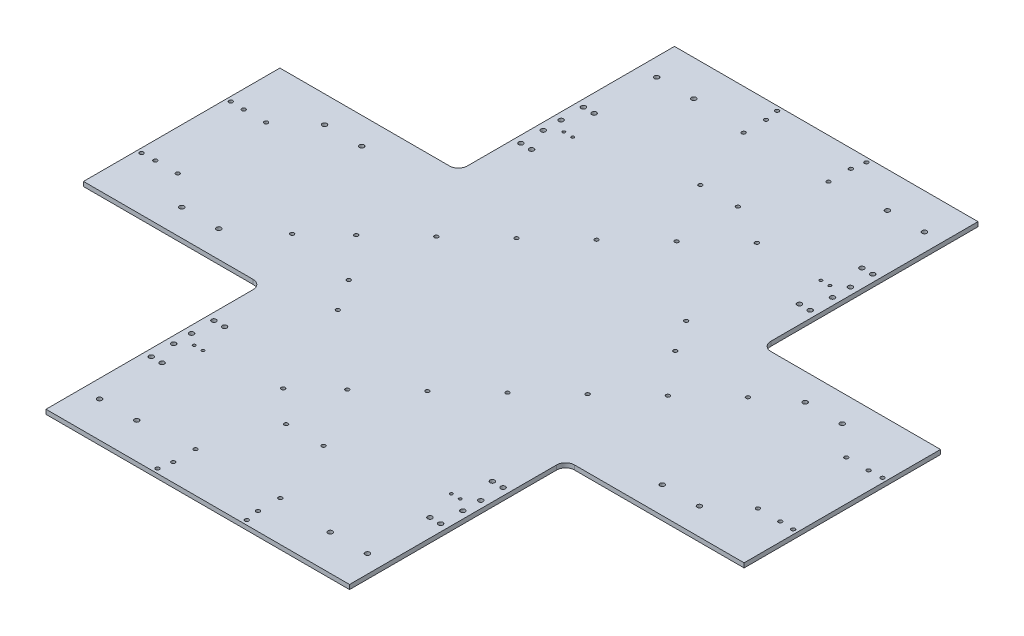
from build123d import *

# Parameters (mm, degrees)
BOSS_EXTRUDE1_DEPTH = 5
SKETCH2_R           = 2.125
CUT_EXTRUDE1_DEPTH  = 3
SKETCH4_R           = 2.6
SKETCH4_R_2         = 1.6
CUT_EXTRUDE3_DEPTH  = 10
SKETCH5_R           = 2.125
CUT_EXTRUDE4_DEPTH  = 10
FILLET1_R           = 10
SKETCH6_R           = 2.6
CUT_EXTRUDE5_DEPTH  = 10
SKETCH7_R           = 2.125
CUT_EXTRUDE6_DEPTH  = 10
SKETCH9_R           = 2.1
CUT_EXTRUDE7_DEPTH  = 10


with BuildPart() as part:
    # Sketch1 → Boss-Extrude1 (new body)
    with BuildSketch(Plane(origin=(0, 0, 0), x_dir=(1, 0, 0), z_dir=(0, 1, 0))):
        Polygon((170, 352), (-170, 352), (-170, 110), (-370, 110), (-370, -110), (-170, -110), (-170, -352), (170, -352), (170, -110), (370, -110), (370, 110), (170, 110), align=None)
    extrude(amount=BOSS_EXTRUDE1_DEPTH)

    # Sketch2 → Cut-Extrude1 (cut)
    with BuildSketch(Plane(origin=(0, 5, 0), x_dir=(1, 0, 0), z_dir=(0, 1, 0))):
        with Locations((350, 49.5)):
            Circle(SKETCH2_R)
        with Locations((325, 49.5)):
            Circle(SKETCH2_R)
        with Locations((325, -49.5)):
            Circle(SKETCH2_R)
        with Locations((350, -49.5)):
            Circle(SKETCH2_R)
        with Locations((-350, -49.5)):
            Circle(SKETCH2_R)
        with Locations((-325, -49.5)):
            Circle(SKETCH2_R)
        with Locations((-325, 49.5)):
            Circle(SKETCH2_R)
        with Locations((-350, 49.5)):
            Circle(SKETCH2_R)
        with Locations((47.5, 332)):
            Circle(SKETCH2_R)
        with Locations((47.5, 307)):
            Circle(SKETCH2_R)
        with Locations((-47.5, 307)):
            Circle(SKETCH2_R)
        with Locations((-47.5, 332)):
            Circle(SKETCH2_R)
        with Locations((-47.5, -332)):
            Circle(SKETCH2_R)
        with Locations((-47.5, -307)):
            Circle(SKETCH2_R)
        with Locations((47.5, -307)):
            Circle(SKETCH2_R)
        with Locations((47.5, -332)):
            Circle(SKETCH2_R)
    extrude(amount=-CUT_EXTRUDE1_DEPTH, mode=Mode.SUBTRACT)

    # Sketch4 → Cut-Extrude3 (cut)
    with BuildSketch(Plane(origin=(0, 5, 0), x_dir=(1, 0, 0), z_dir=(0, 1, 0))):
        with Locations((-162, 172)):
            Circle(SKETCH4_R)
        with Locations((-150, 172)):
            Circle(SKETCH4_R)
        with Locations((-162, 197)):
            Circle(SKETCH4_R)
        with Locations((-162, 217)):
            Circle(SKETCH4_R)
        with Locations((-162, 242)):
            Circle(SKETCH4_R)
        with Locations((-150, 242)):
            Circle(SKETCH4_R)
        with Locations((150, 242)):
            Circle(SKETCH4_R)
        with Locations((162, 242)):
            Circle(SKETCH4_R)
        with Locations((162, 217)):
            Circle(SKETCH4_R)
        with Locations((162, 197)):
            Circle(SKETCH4_R)
        with Locations((150, 172)):
            Circle(SKETCH4_R)
        with Locations((162, 172)):
            Circle(SKETCH4_R)
        with Locations((162, -172)):
            Circle(SKETCH4_R)
        with Locations((150, -172)):
            Circle(SKETCH4_R)
        with Locations((162, -197)):
            Circle(SKETCH4_R)
        with Locations((162, -217)):
            Circle(SKETCH4_R)
        with Locations((162, -242)):
            Circle(SKETCH4_R)
        with Locations((150, -242)):
            Circle(SKETCH4_R)
        with Locations((-150, -242)):
            Circle(SKETCH4_R)
        with Locations((-162, -242)):
            Circle(SKETCH4_R)
        with Locations((-162, -217)):
            Circle(SKETCH4_R)
        with Locations((-162, -197)):
            Circle(SKETCH4_R)
        with Locations((-150, -172)):
            Circle(SKETCH4_R)
        with Locations((-162, -172)):
            Circle(SKETCH4_R)
        with Locations((149, -207)):
            Circle(SKETCH4_R_2)
        with Locations((-149, -207)):
            Circle(SKETCH4_R_2)
        with Locations((149, 207)):
            Circle(SKETCH4_R_2)
        with Locations((-149, 207)):
            Circle(SKETCH4_R_2)
        with Locations((139, -207)):
            Circle(SKETCH4_R_2)
        with Locations((-139, -207)):
            Circle(SKETCH4_R_2)
        with Locations((139, 207)):
            Circle(SKETCH4_R_2)
        with Locations((-139, 207)):
            Circle(SKETCH4_R_2)
    extrude(amount=-CUT_EXTRUDE3_DEPTH, mode=Mode.SUBTRACT)

    # Sketch5 → Cut-Extrude4 (cut)
    with BuildSketch(Plane(origin=(0, 5, 0), x_dir=(1, 0, 0), z_dir=(0, 1, 0))):
        with Locations((-50, 347)):
            Circle(SKETCH5_R)
        with Locations((50, 347)):
            Circle(SKETCH5_R)
        with Locations((50, -347)):
            Circle(SKETCH5_R)
        with Locations((-50, -347)):
            Circle(SKETCH5_R)
        with Locations((-365, 50)):
            Circle(SKETCH5_R)
        with Locations((-365, -50)):
            Circle(SKETCH5_R)
        with Locations((365, -50)):
            Circle(SKETCH5_R)
        with Locations((365, 50)):
            Circle(SKETCH5_R)
    extrude(amount=-CUT_EXTRUDE4_DEPTH, mode=Mode.SUBTRACT)

    # Fillet1
    fillet1_edges = [part.edges().sort_by_distance(p)[0] for p in [
        (-170, 2.5, -110),
        (-170, 2.5, 110),
        (170, 2.5, 110),
        (170, 2.5, -110),
    ]]
    fillet(fillet1_edges, radius=FILLET1_R)

    # Sketch6 → Cut-Extrude5 (cut)
    with BuildSketch(Plane(origin=(0, 5, 0), x_dir=(1, 0, 0), z_dir=(0, 1, 0))):
        with Locations((-150, 312)):
            Circle(SKETCH6_R)
        with Locations((-108.4, 312)):
            Circle(SKETCH6_R)
        with Locations((108.4, 312)):
            Circle(SKETCH6_R)
        with Locations((150, 312)):
            Circle(SKETCH6_R)
        with Locations((150, -312)):
            Circle(SKETCH6_R)
        with Locations((108.4, -312)):
            Circle(SKETCH6_R)
        with Locations((-108.4, -312)):
            Circle(SKETCH6_R)
        with Locations((-150, -312)):
            Circle(SKETCH6_R)
        with Locations((248.4, 80)):
            Circle(SKETCH6_R)
        with Locations((290, 80)):
            Circle(SKETCH6_R)
        with Locations((290, -80)):
            Circle(SKETCH6_R)
        with Locations((248.4, -80)):
            Circle(SKETCH6_R)
        with Locations((-248.4, -80)):
            Circle(SKETCH6_R)
        with Locations((-290, -80)):
            Circle(SKETCH6_R)
        with Locations((-290, 80)):
            Circle(SKETCH6_R)
        with Locations((-248.4, 80)):
            Circle(SKETCH6_R)
    extrude(amount=-CUT_EXTRUDE5_DEPTH, mode=Mode.SUBTRACT)

    # Sketch7 → Cut-Extrude6 (cut)
    with BuildSketch(Plane(origin=(0, 5, 0), x_dir=(1, 0, 0), z_dir=(0, 1, 0))):
        with Locations((-72.423012394, 77.400951388)):
            Circle(SKETCH7_R)
        with Locations((-26.055461327, 120.786435228)):
            Circle(SKETCH7_R)
        with Locations((20.31208974, 164.171919068)):
            Circle(SKETCH7_R)
        with Locations((66.679640807, 207.557402908)):
            Circle(SKETCH7_R)
        with Locations((-118.790563461, 34.015467548)):
            Circle(SKETCH7_R)
        with Locations((-165.158114529, -9.370016292)):
            Circle(SKETCH7_R)
        with Locations((-202.252155383, -44.078403364)):
            Circle(SKETCH7_R)
        with Locations((-57.406130594, -198.88030614)):
            Circle(SKETCH7_R)
        with Locations((-20.31208974, -164.171919068)):
            Circle(SKETCH7_R)
        with Locations((26.055461327, -120.786435228)):
            Circle(SKETCH7_R)
        with Locations((211.525665596, 52.755500132)):
            Circle(SKETCH7_R)
        with Locations((165.158114529, 9.370016292)):
            Circle(SKETCH7_R)
        with Locations((118.790563461, -34.015467548)):
            Circle(SKETCH7_R)
        with Locations((72.423012394, -77.400951388)):
            Circle(SKETCH7_R)
    extrude(amount=-CUT_EXTRUDE6_DEPTH, mode=Mode.SUBTRACT)

    # Sketch9 → Cut-Extrude7 (cut)
    with BuildSketch(Plane(origin=(0, 5, 0), x_dir=(1, 0, 0), z_dir=(0, 1, 0))):
        with Locations((-125.801601874, -57.071840092)):
            Circle(SKETCH9_R)
        with Locations((-102.837073616, -92.237596758)):
            Circle(SKETCH9_R)
        with Locations((102.837073616, 92.237596758)):
            Circle(SKETCH9_R)
        with Locations((125.801601874, 57.071840092)):
            Circle(SKETCH9_R)
        with Locations((21, 232)):
            Circle(SKETCH9_R)
        with Locations((-21, 232)):
            Circle(SKETCH9_R)
        with Locations((-21, -232)):
            Circle(SKETCH9_R)
        with Locations((21, -232)):
            Circle(SKETCH9_R)
    extrude(amount=-CUT_EXTRUDE7_DEPTH, mode=Mode.SUBTRACT)


solid = part.part
